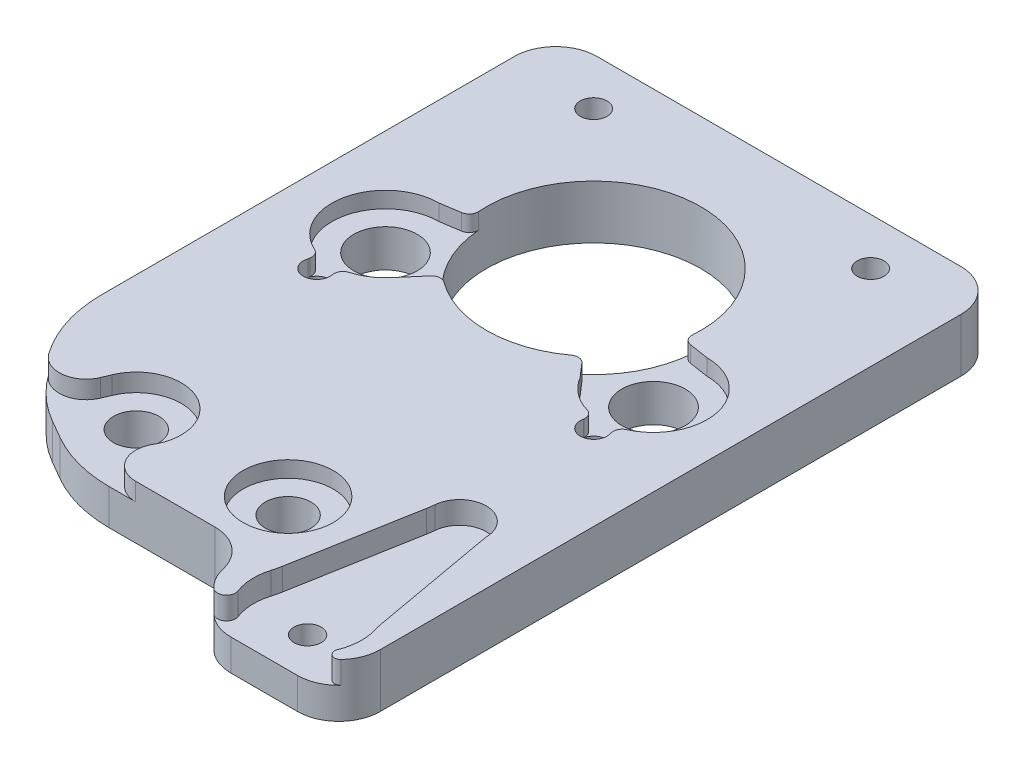
from build123d import *

# Parameters (mm, degrees)
SKETCH1_R           = 3.55
SKETCH1_R_2         = 12
SKETCH1_R_3         = 1.5
SKETCH1_R_4         = 2.55
BOSS_EXTRUDE1_DEPTH = 6
SKETCH2_R           = 5.05
CUT_EXTRUDE1_DEPTH  = 1.8
SKETCH11_R          = 1.52
CUT_EXTRUDE9_DEPTH  = 13
SKETCH14_W          = 37.681595327
SKETCH14_H          = 11.476856365
CUT_EXTRUDE13_DEPTH = 10
FILLET1_R           = 4.635
FILLET2_R           = 4.635
SKETCH15_R          = 3
CUT_EXTRUDE14_DEPTH = 3
CHAMFER1_SIZE       = 7.5
CHAMFER1_SIZE2      = 12.990381057
FILLET4_R           = 15
CUT_EXTRUDE15_START = 6
CUT_EXTRUDE15_DEPTH = 2
FILLET5_R           = 3
FILLET6_R           = 1
CUT_EXTRUDE16_START = 6
CUT_EXTRUDE16_DEPTH = 2.5
FILLET7_R           = 1
FILLET8_R           = 0.7
FILLET9_R           = 10


with BuildPart() as part:
    # Sketch1 → Boss-Extrude1 (new body)
    with BuildSketch(Plane(origin=(0, 0, 0), x_dir=(1, 0, 0), z_dir=(0, 1, 0))):
        with BuildLine():
            Line((-20.365, 45), (20.365, 45))
            ThreePointArc((20.365, 45), (23.642439931, 43.642439931), (25, 40.365))
            Line((25, 40.365), (25, -24.635))
            ThreePointArc((25, -24.635), (23.642439931, -27.912439931), (20.365, -29.27))
            Line((20.365, -29.27), (-20.365, -29.27))
            Line((-20.365, -29.27), (-25, -29.27))
            Line((-25, -29.27), (-25, -20.365))
            Line((-25, -20.365), (-25, 40.365))
            ThreePointArc((-25, 40.365), (-23.642439931, 43.642439931), (-20.365, 45))
        make_face()
        with Locations(Location((-15, 15.95, 0), (0, 0, 270))):
            Circle(SKETCH1_R, mode=Mode.SUBTRACT)
        with Locations(Location((0, 24.25, 0), (0, 0, 270))):
            Circle(SKETCH1_R_2, mode=Mode.SUBTRACT)
        with Locations(Location((15.5, 39.75, 0), (0, 0, 270))):
            Circle(SKETCH1_R_3, mode=Mode.SUBTRACT)
        with Locations(Location((-15.5, 39.75, 0), (0, 0, 90))):
            Circle(SKETCH1_R_3, mode=Mode.SUBTRACT)
        with Locations(Location((15.5, 8.75, 0), (0, 0, 90))):
            Circle(SKETCH1_R_3, mode=Mode.SUBTRACT)
        with Locations(Location((-15.5, 8.75, 0), (0, 0, 270))):
            Circle(SKETCH1_R_3, mode=Mode.SUBTRACT)
        with Locations(Location((5, -14.95, 0), (0, 0, 270))):
            Circle(SKETCH1_R_4, mode=Mode.SUBTRACT)
        with Locations(Location((15, 15.95, 0), (0, 0, 90))):
            Circle(SKETCH1_R, mode=Mode.SUBTRACT)
        with Locations(Location((-12, -14.95, 0), (0, 0, 90))):
            Circle(SKETCH1_R_4, mode=Mode.SUBTRACT)
    extrude(amount=BOSS_EXTRUDE1_DEPTH)

    # Sketch2 → Cut-Extrude1 (cut)
    with BuildSketch(Plane(origin=(0, 6, 0), x_dir=(1, 0, 0), z_dir=(0, 1, 0))):
        with Locations(Location((5, -14.95, 0), (0, 0, 270))):
            Circle(SKETCH2_R)
        with Locations(Location((-12, -14.95, 0), (0, 0, 270))):
            Circle(SKETCH2_R)
        with BuildLine():
            Line((-7.5, 23.1), (-15, 21.95))
            ThreePointArc((-15, 21.95), (-20.935673069, 16.826233541), (-16.733678611, 10.205928406))
            Line((-16.733678611, 10.205928406), (-16.932966202, 9.193404855))
            Line((-16.932966202, 9.193404855), (-14, 8.75))
            Line((-14, 8.75), (-14.130110059, 10.013393942))
            ThreePointArc((-14.130110059, 10.013393942), (-12.101208946, 10.696714321), (-10.441369548, 12.048860628))
            Line((-10.441369548, 12.048860628), (-5.220684774, 18.149430314))
            Line((-5.220684774, 18.149430314), (-7.5, 23.1))
        make_face()
        with BuildLine():
            Line((4.956760879, 18.508794553), (9.839172222, 12.889631289))
            ThreePointArc((9.839172222, 12.889631289), (11.659255417, 10.966083304), (14.130110059, 10.013393942))
            Line((14.130110059, 10.013393942), (14, 8.75))
            Line((14, 8.75), (16.988984535, 8.931452623))
            Line((16.988984535, 8.931452623), (16.718687374, 10.201425071))
            ThreePointArc((16.718687374, 10.201425071), (20.936810995, 16.818490192), (15, 21.95))
            Line((15, 21.95), (7.5, 23.1))
            Line((7.5, 23.1), (4.956760879, 18.508794553))
        make_face()
    extrude(amount=-CUT_EXTRUDE1_DEPTH, mode=Mode.SUBTRACT)

    # Sketch11 → Cut-Extrude9 (cut)
    with BuildSketch(Plane(origin=(0, 0, 0), x_dir=(1, 0, 0), z_dir=(0, 1, 0))):
        with Locations(Location((17, -24.772297108, 0), (0, 0, 270))):
            Circle(SKETCH11_R)
    extrude(amount=CUT_EXTRUDE9_DEPTH, mode=Mode.SUBTRACT)

    # Sketch14 → Cut-Extrude13 (cut)
    with BuildSketch(Plane(origin=(0, 0, 0), x_dir=(1, 0, 0), z_dir=(0, 1, 0))):
        with Locations((-10.340797664, -27.738428183)):
            Rectangle(SKETCH14_W, SKETCH14_H)
    extrude(amount=CUT_EXTRUDE13_DEPTH, mode=Mode.SUBTRACT)

    # Fillet1
    fillet1_edges = [part.edges().sort_by_distance(p)[0] for p in [
        (8.5, 3, 22),
    ]]
    fillet(fillet1_edges, radius=FILLET1_R)

    # Fillet2
    fillet2_edges = [part.edges().sort_by_distance(p)[0] for p in [
        (8.5, 3, 29.27),
    ]]
    fillet(fillet2_edges, radius=FILLET2_R)

    # Sketch15 → Cut-Extrude14 (cut)
    with BuildSketch(Plane(origin=(0, 0, 0), x_dir=(1, 0, 0), z_dir=(0, 1, 0))):
        with Locations(Location((-15.5, 8.75, 0), (0, 0, 270))):
            Circle(SKETCH15_R)
        with Locations(Location((15.5, 8.75, 0), (0, 0, 270))):
            Circle(SKETCH15_R)
    extrude(amount=CUT_EXTRUDE14_DEPTH, mode=Mode.SUBTRACT)

    # Chamfer1
    chamfer1_edges = [part.edges().sort_by_distance(p)[0] for p in [
        (-25, 3, 22),
    ]]
    chamfer1_side = [part.faces().sort_by_distance(p)[0] for p in [
        (-25, 3, -9.1825),
    ]]
    chamfer(chamfer1_edges, length=CHAMFER1_SIZE, length2=CHAMFER1_SIZE2, reference=chamfer1_side[0])

    # Fillet4
    fillet4_edges = [part.edges().sort_by_distance(p)[0] for p in [
        (-12.009618943, 3, 22),
        (-25, 3, 14.5),
    ]]
    fillet(fillet4_edges, radius=FILLET4_R)

    # Sketch16 → Cut-Extrude15 (cut)
    with BuildSketch(Plane(origin=(0, 0, 0), x_dir=(1, 0, 0), z_dir=(0, 1, 0)).offset(CUT_EXTRUDE15_START)):
        with BuildLine():
            Line((-16.664609357, -13.015078929), (-20.669862741, -22.670740182))
            Line((-20.669862741, -22.670740182), (-11.293848706, -27.720919461))
            Line((-11.293848706, -27.720919461), (-7.723076168, -17.635222996))
            ThreePointArc((-7.723076168, -17.635222996), (-9.681809366, -10.463521182), (-16.664609357, -13.015078929))
        make_face()
    extrude(amount=-CUT_EXTRUDE15_DEPTH, mode=Mode.SUBTRACT)

    # Fillet5
    # the kernel refuses this fillet: 3 mm, written as the material it takes off along each edge
    with BuildSketch(Plane(origin=(-9.249648628, 16.565462004, 21.947048042), x_dir=(0.3337437483266481, 0, -0.9426638374589739), z_dir=(0, -1, 0))) as fillet5_piece_1:
        with BuildLine():
            CenterArc((4.188427656, 3), FILLET5_R, 160.503835971, 109.496164029)
            Line((1.360436144, 4.001231245), (1.077636993, 4.101354369))
            ThreePointArc((1.077636993, 4.101354369), (0.087557633, 1.30486151), (-0.290206287, 0.076028357))
            Line((-0.290206287, 0.076028357), (0, -0.3))
            Line((0, -0.3), (4.188427656, -0.3))
            Line((4.188427656, -0.3), (4.188427656, 0))
        make_face()
    extrude(amount=12.565462004, mode=Mode.SUBTRACT)
    with BuildSketch(Plane(origin=(-18.743864962, 18.470022706, 18.027642644), x_dir=(0.3831526873327851, 0, -0.9236850210919656), z_dir=(0, -1, 0))) as fillet5_piece_2:
        with BuildLine():
            CenterArc((4.461410952, -3), FILLET5_R, 90, 122.26907024)
            ThreePointArc((1.92476045, -4.601687931), (0.769762504, -2.381410701), (0, 0))
            Line((0, 0), (4.461410952, 0))
        make_face()
    extrude(amount=14.470022706, mode=Mode.SUBTRACT)

    # Fillet6
    fillet6_edges = [part.edges().sort_by_distance(p)[0] for p in [
        (-14.130110059, 5.1, -10.013393942),
        (-16.733678611, 5.1, -10.205928406),
        (14.130110059, 5.1, -10.013393942),
        (16.718687374, 5.1, -10.201425071),
        (11.861373055, 5.1, -22.431256132),
        (7.852565986, 5.1, -15.176014799),
        (-7.802278744, 5.1, -15.132739095),
        (-11.861373055, 5.1, -22.431256132),
    ]]
    fillet(fillet6_edges, radius=FILLET6_R)

    # Sketch17 → Cut-Extrude16 (cut)
    with BuildSketch(Plane(origin=(0, 0, 0), x_dir=(1, 0, 0), z_dir=(0, 1, 0)).offset(CUT_EXTRUDE16_START)):
        with BuildLine():
            Line((11.327335926, -22.66911326), (14, -7.772297108))
            ThreePointArc((14, -7.772297108), (17, -4.772297108), (20, -7.772297108))
            Line((20, -7.772297108), (22.672664074, -22.66911326))
            ThreePointArc((22.672664074, -22.66911326), (17, -30.822297108), (11.327335926, -22.66911326))
        make_face()
    extrude(amount=-CUT_EXTRUDE16_DEPTH, mode=Mode.SUBTRACT)

    # Fillet7
    # the kernel refuses this fillet: 1 mm, written as the material it takes off along each edge
    with BuildSketch(Plane(origin=(12.953622769, 3.5, 29.27), x_dir=(-0.9295463102395678, 0, -0.36870537983599505), z_dir=(0, 1, 0))) as fillet7_piece_1:
        with BuildLine():
            CenterArc((3.110158636, -0.926607536), FILLET7_R, 67.912019708, 154.403348054)
            Line((2.370708081, -1.599818408), (2.296763026, -1.667139495))
            ThreePointArc((2.296763026, -1.667139495), (1.225310358, -0.740699506), (-0.034759798, -0.093764367))
            Line((-0.034759798, -0.093764367), (-0.036870538, 0.092954631))
            ThreePointArc((-0.036870538, 0.092954631), (-0.002529968, 0.106575849), (3.523791509, 0.092660754))
            Line((3.523791509, 0.092660754), (3.48618852, 0))
        make_face()
    extrude(amount=11.215471301, mode=Mode.SUBTRACT)

    # Fillet8
    fillet8_edges = [part.edges().sort_by_distance(p)[0] for p in [
        (21.112884992, 4.75, 29.209264207),
    ]]
    fillet(fillet8_edges, radius=FILLET8_R)

    # Fillet9
    fillet9_edges = [part.edges().sort_by_distance(p)[0] for p in [
        (22.672664074, 4.75, 22.66911326),
        (20, 4.75, 7.772297108),
        (11.327335926, 4.75, 22.66911326),
        (14, 4.75, 7.772297108),
    ]]
    fillet(fillet9_edges, radius=FILLET9_R)


solid = part.part
